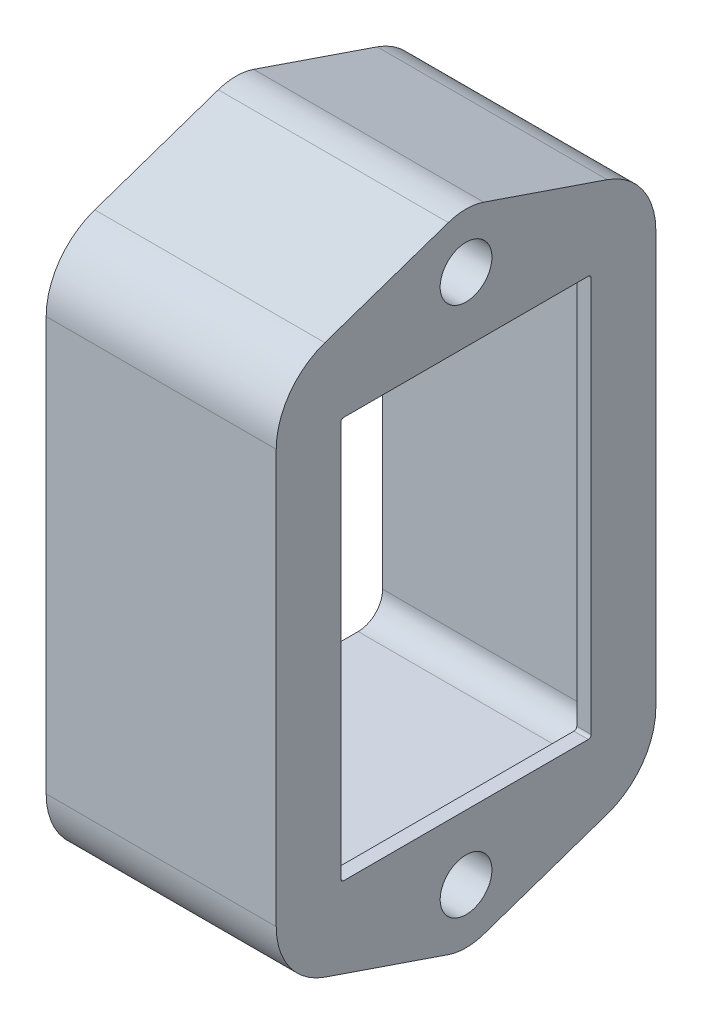
from build123d import *

# Parameters (mm, degrees)
SALIENTE_EXTRUIR1_DEPTH      = 2
SALIENTE_EXTRUIR1_DEPTH_BACK = 30
CROQUIS2_R                   = 3.6
SALIENTE_EXTRUIR2_START      = -2
SALIENTE_EXTRUIR2_DEPTH      = 2


with BuildPart() as part:
    # Croquis2 → Saliente-Extruir1 (new, two sides: drawn at the far end of the back side and taken through both)
    with BuildSketch(Plane(origin=(0, 0, 0), x_dir=(0, 0, -1), z_dir=(1, 0, 0)).offset(-SALIENTE_EXTRUIR1_DEPTH_BACK)):
        with BuildLine():
            Line((-26.4, -41.464925013), (-26.4, 16.039678623))
            ThreePointArc((-26.4, 16.039678623), (-24.535471531, 21.85466813), (-19.637179406, 25.501214941))
            Line((-19.637179406, 25.501214941), (-2.460256349, 31.378144407))
            ThreePointArc((-2.460256349, 31.378144407), (0, 31.787376805), (2.460256349, 31.378144407))
            Line((2.460256349, 31.378144407), (19.637179406, 25.501214941))
            ThreePointArc((19.637179406, 25.501214941), (24.535471531, 21.85466813), (26.4, 16.039678623))
            Line((26.4, 16.039678623), (26.4, -41.464925013))
            ThreePointArc((26.4, -41.464925013), (24.535471531, -47.27991452), (19.637179406, -50.92646133))
            Line((19.637179406, -50.92646133), (2.460256349, -56.803390796))
            ThreePointArc((2.460256349, -56.803390796), (0, -57.212623195), (-2.460256349, -56.803390796))
            Line((-2.460256349, -56.803390796), (-19.637179406, -50.92646133))
            ThreePointArc((-19.637179406, -50.92646133), (-24.535471531, -47.27991452), (-26.4, -41.464925013))
        make_face()
        with Locations((0, 24.187376805)):
            Circle(CROQUIS2_R, mode=Mode.SUBTRACT)
        with Locations((0, -49.612623195)):
            Circle(CROQUIS2_R, mode=Mode.SUBTRACT)
        with BuildLine():
            Line((20.4, -40.212623195), (20.4, 14.787376805))
            ThreePointArc((20.4, 14.787376805), (19.404163056, 17.191539861), (17, 18.187376805))
            Line((17, 18.187376805), (0, 18.187376805))
            Line((0, 18.187376805), (-17, 18.187376805))
            ThreePointArc((-17, 18.187376805), (-19.404163056, 17.191539861), (-20.4, 14.787376805))
            Line((-20.4, 14.787376805), (-20.4, -40.212623195))
            ThreePointArc((-20.4, -40.212623195), (-19.404163056, -42.616786251), (-17, -43.612623195))
            Line((-17, -43.612623195), (0, -43.612623195))
            Line((0, -43.612623195), (17, -43.612623195))
            ThreePointArc((17, -43.612623195), (19.404163056, -42.616786251), (20.4, -40.212623195))
        make_face(mode=Mode.SUBTRACT)
    extrude(amount=SALIENTE_EXTRUIR1_DEPTH + SALIENTE_EXTRUIR1_DEPTH_BACK)

    # Croquis3 → Saliente-Extruir2 (add)
    with BuildSketch(Plane(origin=(2, 0, 0), x_dir=(0, 0, -1), z_dir=(1, 0, 0)).offset(SALIENTE_EXTRUIR2_START)):
        with BuildLine():
            Line((-17, -43.612623195), (17, -43.612623195))
            ThreePointArc((17, -43.612623195), (19.404163056, -42.616786251), (20.4, -40.212623195))
            Line((20.4, -40.212623195), (20.4, 14.787376805))
            ThreePointArc((20.4, 14.787376805), (19.404163056, 17.191539861), (17, 18.187376805))
            Line((17, 18.187376805), (-17, 18.187376805))
            ThreePointArc((-17, 18.187376805), (-19.404163056, 17.191539861), (-20.4, 14.787376805))
            Line((-20.4, 14.787376805), (-20.4, -40.212623195))
            ThreePointArc((-20.4, -40.212623195), (-19.404163056, -42.616786251), (-17, -43.612623195))
        make_face()
        with BuildLine():
            Line((-17, -40.612623195), (17, -40.612623195))
            ThreePointArc((17, -40.612623195), (17.282842712, -40.495465907), (17.4, -40.212623195))
            Line((17.4, -40.212623195), (17.4, 14.787376805))
            ThreePointArc((17.4, 14.787376805), (17.282842712, 15.070219518), (17, 15.187376805))
            Line((17, 15.187376805), (-17, 15.187376805))
            ThreePointArc((-17, 15.187376805), (-17.282842712, 15.070219518), (-17.4, 14.787376805))
            Line((-17.4, 14.787376805), (-17.4, -40.212623195))
            ThreePointArc((-17.4, -40.212623195), (-17.282842712, -40.495465907), (-17, -40.612623195))
        make_face(mode=Mode.SUBTRACT)
    extrude(amount=SALIENTE_EXTRUIR2_DEPTH)


solid = part.part
